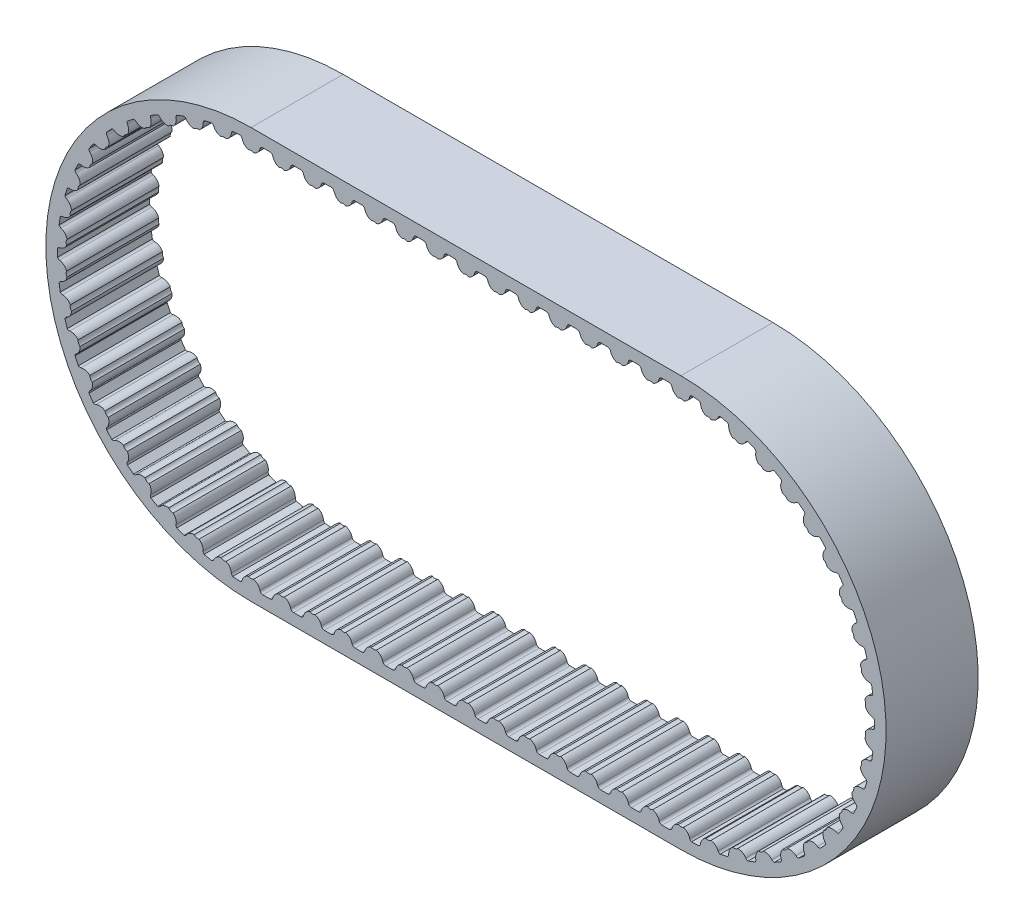
from build123d import *

# Parameters (mm, degrees)
BOSS_EXTRUDE2_DEPTH      = 7.5
BOSS_EXTRUDE2_DEPTH_BACK = 7.5
BOSS_EXTRUDE1_DEPTH      = 7.5
CRVPATTERN3_START        = -7.5
CRVPATTERN3_DEPTH        = 15


# Read off the part's stored shape, not the designer's step: CrvPattern3
with BuildPart() as part:
    # Sketch3 → Boss-Extrude2 (new, two sides: drawn at the far end of the back side and taken through both)
    with BuildSketch(Plane.XY.offset(-BOSS_EXTRUDE2_DEPTH_BACK)):
        with BuildLine():
            Line((-35, -33.422538049), (35, -33.422538049))
            ThreePointArc((35, -33.422538049), (68.422538049, 0), (35, 33.422538049))
            Line((35, 33.422538049), (-35, 33.422538049))
            ThreePointArc((-35, 33.422538049), (-68.422538049, 0), (-35, -33.422538049))
        make_face()
        with BuildLine():
            Line((-35, 31.522538049), (35, 31.522538049))
            ThreePointArc((35, 31.522538049), (66.522538049, 0), (35, -31.522538049))
            Line((35, -31.522538049), (-35, -31.522538049))
            ThreePointArc((-35, -31.522538049), (-66.522538049, 0), (-35, 31.522538049))
        make_face(mode=Mode.SUBTRACT)
    extrude(amount=BOSS_EXTRUDE2_DEPTH + BOSS_EXTRUDE2_DEPTH_BACK)

    # Sketch4 → Boss-Extrude1 (add, symmetric)
    with BuildSketch(Plane.XY):
        with BuildLine():
            Line((-1.936491673, -31.522538049), (1.936491673, -31.522538049))
            ThreePointArc((1.936491673, -31.522538049), (1.630305455, -31.417822757), (1.452368755, -31.147538049))
            ThreePointArc((1.452368755, -31.147538049), (1.075823088, -30.477260726), (0.416666667, -30.08157001))
            ThreePointArc((0.416666667, -30.08157001), (0, -30.193215507), (-0.416666667, -30.08157001))
            ThreePointArc((-0.416666667, -30.08157001), (-1.075823088, -30.477260726), (-1.452368755, -31.147538049))
            ThreePointArc((-1.452368755, -31.147538049), (-1.630305455, -31.417822757), (-1.936491673, -31.522538049))
        make_face()
    extrude(amount=BOSS_EXTRUDE1_DEPTH, both=True)

    # CrvPattern3 outline → CrvPattern3 (add)
    with BuildSketch(Plane.XY.offset(CRVPATTERN3_START)):
        with BuildLine():
            Line((3.063508327, -31.522538049), (6.936491673, -31.522538049))
            ThreePointArc((6.936491673, -31.522538049), (6.630305455, -31.417822757), (6.452368755, -31.147538049))
            ThreePointArc((6.452368755, -31.147538049), (6.075823088, -30.477260726), (5.416666667, -30.08157001))
            ThreePointArc((5.416666667, -30.08157001), (5, -30.193215507), (4.583333333, -30.08157001))
            ThreePointArc((4.583333333, -30.08157001), (3.924176912, -30.477260726), (3.547631245, -31.147538049))
            ThreePointArc((3.547631245, -31.147538049), (3.369694545, -31.417822757), (3.063508327, -31.522538049))
        make_face()
        with BuildLine():
            Line((8.063508327, -31.522538049), (11.936491673, -31.522538049))
            ThreePointArc((11.936491673, -31.522538049), (11.630305455, -31.417822757), (11.452368755, -31.147538049))
            ThreePointArc((11.452368755, -31.147538049), (11.075823088, -30.477260726), (10.416666667, -30.08157001))
            ThreePointArc((10.416666667, -30.08157001), (10, -30.193215507), (9.583333333, -30.08157001))
            ThreePointArc((9.583333333, -30.08157001), (8.924176912, -30.477260726), (8.547631245, -31.147538049))
            ThreePointArc((8.547631245, -31.147538049), (8.369694545, -31.417822757), (8.063508327, -31.522538049))
        make_face()
        with BuildLine():
            Line((13.063508327, -31.522538049), (16.936491673, -31.522538049))
            ThreePointArc((16.936491673, -31.522538049), (16.630305455, -31.417822757), (16.452368755, -31.147538049))
            ThreePointArc((16.452368755, -31.147538049), (16.075823088, -30.477260726), (15.416666667, -30.08157001))
            ThreePointArc((15.416666667, -30.08157001), (15, -30.193215507), (14.583333333, -30.08157001))
            ThreePointArc((14.583333333, -30.08157001), (13.924176912, -30.477260726), (13.547631245, -31.147538049))
            ThreePointArc((13.547631245, -31.147538049), (13.369694545, -31.417822757), (13.063508327, -31.522538049))
        make_face()
        with BuildLine():
            Line((18.063508327, -31.522538049), (21.936491673, -31.522538049))
            ThreePointArc((21.936491673, -31.522538049), (21.630305455, -31.417822757), (21.452368755, -31.147538049))
            ThreePointArc((21.452368755, -31.147538049), (21.075823088, -30.477260726), (20.416666667, -30.08157001))
            ThreePointArc((20.416666667, -30.08157001), (20, -30.193215507), (19.583333333, -30.08157001))
            ThreePointArc((19.583333333, -30.08157001), (18.924176912, -30.477260726), (18.547631245, -31.147538049))
            ThreePointArc((18.547631245, -31.147538049), (18.369694545, -31.417822757), (18.063508327, -31.522538049))
        make_face()
        with BuildLine():
            Line((23.063508327, -31.522538049), (26.936491673, -31.522538049))
            ThreePointArc((26.936491673, -31.522538049), (26.630305455, -31.417822757), (26.452368755, -31.147538049))
            ThreePointArc((26.452368755, -31.147538049), (26.075823088, -30.477260726), (25.416666667, -30.08157001))
            ThreePointArc((25.416666667, -30.08157001), (25, -30.193215507), (24.583333333, -30.08157001))
            ThreePointArc((24.583333333, -30.08157001), (23.924176912, -30.477260726), (23.547631245, -31.147538049))
            ThreePointArc((23.547631245, -31.147538049), (23.369694545, -31.417822757), (23.063508327, -31.522538049))
        make_face()
        with BuildLine():
            Line((28.063508327, -31.522538049), (31.936491673, -31.522538049))
            ThreePointArc((31.936491673, -31.522538049), (31.630305455, -31.417822757), (31.452368755, -31.147538049))
            ThreePointArc((31.452368755, -31.147538049), (31.075823088, -30.477260726), (30.416666667, -30.08157001))
            ThreePointArc((30.416666667, -30.08157001), (30, -30.193215507), (29.583333333, -30.08157001))
            ThreePointArc((29.583333333, -30.08157001), (28.924176912, -30.477260726), (28.547631245, -31.147538049))
            ThreePointArc((28.547631245, -31.147538049), (28.369694545, -31.417822757), (28.063508327, -31.522538049))
        make_face()
        with BuildLine():
            ThreePointArc((35, -31.522538049), (35.862533418, -31.510735332), (36.724420934, -31.475336019))
            ThreePointArc((36.724420934, -31.475336019), (36.551739442, -31.341858767), (36.452368755, -31.147538049))
            ThreePointArc((36.452368755, -31.147538049), (36.075823088, -30.477260726), (35.416666667, -30.08157001))
            ThreePointArc((35.416666667, -30.08157001), (35, -30.193215507), (34.583333333, -30.08157001))
            ThreePointArc((34.583333333, -30.08157001), (33.924176912, -30.477260726), (33.547631245, -31.147538049))
            ThreePointArc((33.547631245, -31.147538049), (33.369694545, -31.417822757), (33.063508327, -31.522538049))
            Line((33.063508327, -31.522538049), (35, -31.522538049))
        make_face()
        with BuildLine():
            ThreePointArc((37.985994832, -31.380794125), (39.698190506, -31.170457344), (41.396315985, -30.866770917))
            ThreePointArc((41.396315985, -30.866770917), (41.205669451, -30.760521337), (41.078446652, -30.583181454))
            ThreePointArc((41.078446652, -30.583181454), (40.606207038, -29.976511793), (39.895438209, -29.683482783))
            ThreePointArc((39.895438209, -29.683482783), (39.500065262, -29.855982237), (39.07141252, -29.807684672))
            ThreePointArc((39.07141252, -29.807684672), (38.478592972, -30.297198015), (38.206152661, -31.016110115))
            ThreePointArc((38.206152661, -31.016110115), (38.136853862, -31.223070862), (37.985994832, -31.380794125))
        make_face()
        with BuildLine():
            ThreePointArc((42.629708408, -30.585257146), (44.291431201, -30.122080129), (45.925327908, -29.568693159))
            ThreePointArc((45.925327908, -29.568693159), (45.720975059, -29.49204469), (45.568742096, -29.335647121))
            ThreePointArc((45.568742096, -29.335647121), (45.011357587, -28.806137122), (44.264853751, -28.622315601))
            ThreePointArc((44.264853751, -28.622315601), (43.899606503, -28.851815658), (43.468543079, -28.867944913))
            ThreePointArc((43.468543079, -28.867944913), (42.955303014, -29.440345966), (42.793053924, -30.191833533))
            ThreePointArc((42.793053924, -30.191833533), (42.755375035, -30.40681115), (42.629708408, -30.585257146))
        make_face()
        with BuildLine():
            ThreePointArc((47.102986906, -29.106496062), (48.677116675, -28.400825419), (50.210286058, -27.610099657))
            ThreePointArc((50.210286058, -27.610099657), (49.9967918, -27.5647645), (49.822949306, -27.432802908))
            ThreePointArc((49.822949306, -27.432802908), (49.192870951, -26.992280949), (48.42730777, -26.921773186))
            ThreePointArc((48.42730777, -26.921773186), (48.10034524, -27.203147194), (47.67650038, -27.283342968))
            ThreePointArc((47.67650038, -27.283342968), (47.254304732, -27.925845237), (47.20587124, -28.69312128))
            ThreePointArc((47.20587124, -28.69312128), (47.200653944, -28.911313522), (47.102986906, -29.106496062))
        make_face()
        with BuildLine():
            ThreePointArc((51.305904675, -26.977543954), (52.757277964, -26.045143201), (54.155471552, -25.034742153))
            ThreePointArc((54.155471552, -25.034742153), (53.937604994, -25.02173302), (53.746036322, -24.91715521))
            ThreePointArc((53.746036322, -24.91715521), (53.057339031, -24.575461822), (52.289817921, -24.619842844))
            ThreePointArc((52.289817921, -24.619842844), (52.008443913, -24.946805373), (51.601285609, -25.089276226))
            ThreePointArc((51.601285609, -25.089276226), (51.279565532, -25.787527271), (51.346029563, -26.553452112))
            ThreePointArc((51.346029563, -26.553452112), (51.373390406, -26.769984924), (51.305904675, -26.977543954))
        make_face()
        with BuildLine():
            ThreePointArc((55.144575479, -24.245958093), (56.440771006, -23.107655522), (57.672755465, -21.900149877))
            ThreePointArc((57.672755465, -21.900149877), (57.455383387, -21.919757371), (57.250367864, -21.844899438))
            ThreePointArc((57.250367864, -21.844899438), (56.518435996, -21.609667488), (55.76610211, -21.767945896))
            ThreePointArc((55.76610211, -21.767945896), (55.536602054, -22.133193144), (55.155225551, -22.334756511))
            ThreePointArc((55.155225551, -22.334756511), (54.941167739, -23.073158558), (55.121044596, -23.820622702))
            ThreePointArc((55.121044596, -23.820622702), (55.180372382, -24.0306591), (55.144575479, -24.245958093))
        make_face()
        with BuildLine():
            ThreePointArc((58.533249755, -20.972757593), (59.645312654, -19.653981002), (60.683567487, -18.276344443))
            ThreePointArc((60.683567487, -18.276344443), (60.471545619, -18.328130564), (60.257662955, -18.28466471))
            ThreePointArc((60.257662955, -18.28466471), (59.498846658, -18.161148891), (58.778505894, -18.429789008))
            ThreePointArc((58.778505894, -18.429789008), (58.606006441, -18.825161954), (58.258931059, -19.081315243))
            ThreePointArc((58.258931059, -19.081315243), (58.157317211, -19.84337361), (58.446588741, -20.555679943))
            ThreePointArc((58.446588741, -20.555679943), (58.536558186, -20.75452806), (58.533249755, -20.972757593))
        make_face()
        with BuildLine():
            ThreePointArc((61.396230118, -17.231060345), (62.299318742, -15.761269025), (63.120651052, -14.244275674))
            ThreePointArc((63.120651052, -14.244275674), (62.918715614, -14.327083607), (62.700743593, -14.315980787))
            ThreePointArc((62.700743593, -14.315980787), (61.93199357, -14.306940239), (61.259737148, -14.679941087))
            ThreePointArc((61.259737148, -14.679941087), (61.148091651, -15.096607754), (60.843070481, -15.401628923))
            ThreePointArc((60.843070481, -15.401628923), (60.856170482, -16.170320487), (61.248374839, -16.831557262))
            ThreePointArc((61.248374839, -16.831557262), (61.366976173, -17.01477516), (61.396230118, -17.231060345))
        make_face()
        with BuildLine():
            ThreePointArc((63.669562319, -13.104449682), (64.34350316, -11.516476341), (64.92956574, -9.894013325))
            ThreePointArc((64.92956574, -9.894013325), (64.742227637, -10.005993276), (64.525035394, -10.02750151))
            ThreePointArc((64.525035394, -10.02750151), (63.76352425, -10.133138183), (63.154369268, -10.60216754))
            ThreePointArc((63.154369268, -10.60216754), (63.106071703, -11.030820282), (62.849918414, -11.377895664))
            ThreePointArc((62.849918414, -11.377895664), (62.977439631, -12.136049124), (63.463815616, -12.731445405))
            ThreePointArc((63.463815616, -12.731445405), (63.608399482, -12.894940298), (63.669562319, -13.104449682))
        make_face()
        with BuildLine():
            ThreePointArc((65.302463873, -8.685107268), (65.732202207, -7.014424607), (66.069903387, -5.322735067))
            ThreePointArc((66.069903387, -5.322735067), (65.901347441, -5.46138559), (65.689786692, -5.515024419))
            ThreePointArc((65.689786692, -5.515024419), (64.952525327, -5.732978564), (64.420079301, -6.28755909))
            ThreePointArc((64.420079301, -6.28755909), (64.436208557, -6.718622514), (64.23464519, -7.099999017))
            ThreePointArc((64.23464519, -7.099999017), (64.47373901, -7.830678478), (65.043421788, -8.346934095))
            ThreePointArc((65.043421788, -8.346934095), (65.210758421, -8.487053779), (65.302463873, -8.685107268))
        make_face()
        with BuildLine():
            ThreePointArc((66.258458458, -4.071753909), (66.434394639, -2.355682218), (66.516190733, -0.632555703))
            ThreePointArc((66.516190733, -0.632555703), (66.370182207, -0.794779575), (66.168978869, -0.879350796))
            ThreePointArc((66.168978869, -0.879350796), (65.472436484, -1.204753678), (65.028593379, -1.83249696))
            ThreePointArc((65.028593379, -1.83249696), (65.108789153, -2.25634182), (64.966318301, -2.663500124))
            ThreePointArc((64.966318301, -2.663500124), (65.311643763, -3.350383415), (65.951907563, -3.775966071))
            ThreePointArc((65.951907563, -3.775966071), (66.138258939, -3.889580502), (66.258458458, -4.071753909))
        make_face()
        with BuildLine():
            ThreePointArc((66.516190733, 0.632555703), (66.434394639, 2.355682218), (66.258458458, 4.071753909))
            ThreePointArc((66.258458458, 4.071753909), (66.138258939, 3.889580502), (65.951907563, 3.775966071))
            ThreePointArc((65.951907563, 3.775966071), (65.311643763, 3.350383415), (64.966318301, 2.663500124))
            ThreePointArc((64.966318301, 2.663500124), (65.108789153, 2.25634182), (65.028593379, 1.83249696))
            ThreePointArc((65.028593379, 1.83249696), (65.472436484, 1.204753678), (66.168978869, 0.879350796))
            ThreePointArc((66.168978869, 0.879350796), (66.370182207, 0.794779575), (66.516190733, 0.632555703))
        make_face()
        with BuildLine():
            ThreePointArc((66.069903387, 5.322735067), (65.732202207, 7.014424607), (65.302463873, 8.685107268))
            ThreePointArc((65.302463873, 8.685107268), (65.210758421, 8.487053779), (65.043421788, 8.346934095))
            ThreePointArc((65.043421788, 8.346934095), (64.47373901, 7.830678478), (64.23464519, 7.099999017))
            ThreePointArc((64.23464519, 7.099999017), (64.436208557, 6.718622514), (64.420079301, 6.28755909))
            ThreePointArc((64.420079301, 6.28755909), (64.952525327, 5.732978564), (65.689786692, 5.515024419))
            ThreePointArc((65.689786692, 5.515024419), (65.901347441, 5.46138559), (66.069903387, 5.322735067))
        make_face()
        with BuildLine():
            ThreePointArc((64.92956574, 9.894013325), (64.34350316, 11.516476341), (63.669562319, 13.104449682))
            ThreePointArc((63.669562319, 13.104449682), (63.608399482, 12.894940298), (63.463815616, 12.731445405))
            ThreePointArc((63.463815616, 12.731445405), (62.977439631, 12.136049124), (62.849918414, 11.377895664))
            ThreePointArc((62.849918414, 11.377895664), (63.106071703, 11.030820282), (63.154369268, 10.60216754))
            ThreePointArc((63.154369268, 10.60216754), (63.76352425, 10.133138183), (64.525035394, 10.02750151))
            ThreePointArc((64.525035394, 10.02750151), (64.742227637, 10.005993276), (64.92956574, 9.894013325))
        make_face()
        with BuildLine():
            ThreePointArc((63.120651052, 14.244275674), (62.299318742, 15.761269025), (61.396230118, 17.231060345))
            ThreePointArc((61.396230118, 17.231060345), (61.366976173, 17.01477516), (61.248374839, 16.831557262))
            ThreePointArc((61.248374839, 16.831557262), (60.856170482, 16.170320487), (60.843070481, 15.401628923))
            ThreePointArc((60.843070481, 15.401628923), (61.148091651, 15.096607754), (61.259737148, 14.679941087))
            ThreePointArc((61.259737148, 14.679941087), (61.93199357, 14.306940239), (62.700743593, 14.315980787))
            ThreePointArc((62.700743593, 14.315980787), (62.918715614, 14.327083607), (63.120651052, 14.244275674))
        make_face()
        with BuildLine():
            ThreePointArc((60.683567487, 18.276344443), (59.645312654, 19.653981002), (58.533249755, 20.972757593))
            ThreePointArc((58.533249755, 20.972757593), (58.536558186, 20.75452806), (58.446588741, 20.555679943))
            ThreePointArc((58.446588741, 20.555679943), (58.157317211, 19.84337361), (58.258931059, 19.081315243))
            ThreePointArc((58.258931059, 19.081315243), (58.606006441, 18.825161954), (58.778505894, 18.429789008))
            ThreePointArc((58.778505894, 18.429789008), (59.498846658, 18.161148891), (60.257662955, 18.28466471))
            ThreePointArc((60.257662955, 18.28466471), (60.471545619, 18.328130564), (60.683567487, 18.276344443))
        make_face()
        with BuildLine():
            ThreePointArc((57.672755465, 21.900149877), (56.440771006, 23.107655522), (55.144575479, 24.245958093))
            ThreePointArc((55.144575479, 24.245958093), (55.180372382, 24.0306591), (55.121044596, 23.820622702))
            ThreePointArc((55.121044596, 23.820622702), (54.941167739, 23.073158558), (55.155225551, 22.334756511))
            ThreePointArc((55.155225551, 22.334756511), (55.536602054, 22.133193144), (55.76610211, 21.767945896))
            ThreePointArc((55.76610211, 21.767945896), (56.518435996, 21.609667488), (57.250367864, 21.844899438))
            ThreePointArc((57.250367864, 21.844899438), (57.455383387, 21.919757371), (57.672755465, 21.900149877))
        make_face()
        with BuildLine():
            ThreePointArc((54.155471552, 25.034742153), (52.757277964, 26.045143201), (51.305904675, 26.977543954))
            ThreePointArc((51.305904675, 26.977543954), (51.373390406, 26.769984924), (51.346029563, 26.553452112))
            ThreePointArc((51.346029563, 26.553452112), (51.279565532, 25.787527271), (51.601285609, 25.089276226))
            ThreePointArc((51.601285609, 25.089276226), (52.008443913, 24.946805373), (52.289817921, 24.619842844))
            ThreePointArc((52.289817921, 24.619842844), (53.057339031, 24.575461822), (53.746036322, 24.91715521))
            ThreePointArc((53.746036322, 24.91715521), (53.937604994, 25.02173302), (54.155471552, 25.034742153))
        make_face()
        with BuildLine():
            ThreePointArc((50.210286058, 27.610099657), (48.677116675, 28.400825419), (47.102986906, 29.106496062))
            ThreePointArc((47.102986906, 29.106496062), (47.200653944, 28.911313522), (47.20587124, 28.69312128))
            ThreePointArc((47.20587124, 28.69312128), (47.254304732, 27.925845237), (47.67650038, 27.283342968))
            ThreePointArc((47.67650038, 27.283342968), (48.10034524, 27.203147194), (48.42730777, 26.921773186))
            ThreePointArc((48.42730777, 26.921773186), (49.192870951, 26.992280949), (49.822949306, 27.432802908))
            ThreePointArc((49.822949306, 27.432802908), (49.9967918, 27.5647645), (50.210286058, 27.610099657))
        make_face()
        with BuildLine():
            ThreePointArc((45.925327908, 29.568693159), (44.291431201, 30.122080129), (42.629708408, 30.585257146))
            ThreePointArc((42.629708408, 30.585257146), (42.755375035, 30.40681115), (42.793053924, 30.191833533))
            ThreePointArc((42.793053924, 30.191833533), (42.955303014, 29.440345966), (43.468543079, 28.867944913))
            ThreePointArc((43.468543079, 28.867944913), (43.899606503, 28.851815658), (44.264853751, 28.622315601))
            ThreePointArc((44.264853751, 28.622315601), (45.011357587, 28.806137122), (45.568742096, 29.335647121))
            ThreePointArc((45.568742096, 29.335647121), (45.720975059, 29.49204469), (45.925327908, 29.568693159))
        make_face()
        with BuildLine():
            ThreePointArc((41.396315985, 30.866770917), (39.698190506, 31.170457344), (37.985994832, 31.380794125))
            ThreePointArc((37.985994832, 31.380794125), (38.136853862, 31.223070862), (38.206152661, 31.016110115))
            ThreePointArc((38.206152661, 31.016110115), (38.478592972, 30.297198015), (39.07141252, 29.807684672))
            ThreePointArc((39.07141252, 29.807684672), (39.500065262, 29.855982237), (39.895438209, 29.683482783))
            ThreePointArc((39.895438209, 29.683482783), (40.606207038, 29.976511793), (41.078446652, 30.583181454))
            ThreePointArc((41.078446652, 30.583181454), (41.205669451, 30.760521337), (41.396315985, 30.866770917))
        make_face()
        with BuildLine():
            Line((35, 31.522538049), (33.063508327, 31.522538049))
            ThreePointArc((33.063508327, 31.522538049), (33.369694545, 31.417822757), (33.547631245, 31.147538049))
            ThreePointArc((33.547631245, 31.147538049), (33.924176912, 30.477260726), (34.583333333, 30.08157001))
            ThreePointArc((34.583333333, 30.08157001), (35, 30.193215507), (35.416666667, 30.08157001))
            ThreePointArc((35.416666667, 30.08157001), (36.075823088, 30.477260726), (36.452368755, 31.147538049))
            ThreePointArc((36.452368755, 31.147538049), (36.551739442, 31.341858767), (36.724420934, 31.475336019))
            ThreePointArc((36.724420934, 31.475336019), (35.862533418, 31.510735332), (35, 31.522538049))
        make_face()
        with BuildLine():
            Line((31.936491673, 31.522538049), (28.063508327, 31.522538049))
            ThreePointArc((28.063508327, 31.522538049), (28.369694545, 31.417822757), (28.547631245, 31.147538049))
            ThreePointArc((28.547631245, 31.147538049), (28.924176912, 30.477260726), (29.583333333, 30.08157001))
            ThreePointArc((29.583333333, 30.08157001), (30, 30.193215507), (30.416666667, 30.08157001))
            ThreePointArc((30.416666667, 30.08157001), (31.075823088, 30.477260726), (31.452368755, 31.147538049))
            ThreePointArc((31.452368755, 31.147538049), (31.630305455, 31.417822757), (31.936491673, 31.522538049))
        make_face()
        with BuildLine():
            Line((26.936491673, 31.522538049), (23.063508327, 31.522538049))
            ThreePointArc((23.063508327, 31.522538049), (23.369694545, 31.417822757), (23.547631245, 31.147538049))
            ThreePointArc((23.547631245, 31.147538049), (23.924176912, 30.477260726), (24.583333333, 30.08157001))
            ThreePointArc((24.583333333, 30.08157001), (25, 30.193215507), (25.416666667, 30.08157001))
            ThreePointArc((25.416666667, 30.08157001), (26.075823088, 30.477260726), (26.452368755, 31.147538049))
            ThreePointArc((26.452368755, 31.147538049), (26.630305455, 31.417822757), (26.936491673, 31.522538049))
        make_face()
        with BuildLine():
            Line((21.936491673, 31.522538049), (18.063508327, 31.522538049))
            ThreePointArc((18.063508327, 31.522538049), (18.369694545, 31.417822757), (18.547631245, 31.147538049))
            ThreePointArc((18.547631245, 31.147538049), (18.924176912, 30.477260726), (19.583333333, 30.08157001))
            ThreePointArc((19.583333333, 30.08157001), (20, 30.193215507), (20.416666667, 30.08157001))
            ThreePointArc((20.416666667, 30.08157001), (21.075823088, 30.477260726), (21.452368755, 31.147538049))
            ThreePointArc((21.452368755, 31.147538049), (21.630305455, 31.417822757), (21.936491673, 31.522538049))
        make_face()
        with BuildLine():
            Line((16.936491673, 31.522538049), (13.063508327, 31.522538049))
            ThreePointArc((13.063508327, 31.522538049), (13.369694545, 31.417822757), (13.547631245, 31.147538049))
            ThreePointArc((13.547631245, 31.147538049), (13.924176912, 30.477260726), (14.583333333, 30.08157001))
            ThreePointArc((14.583333333, 30.08157001), (15, 30.193215507), (15.416666667, 30.08157001))
            ThreePointArc((15.416666667, 30.08157001), (16.075823088, 30.477260726), (16.452368755, 31.147538049))
            ThreePointArc((16.452368755, 31.147538049), (16.630305455, 31.417822757), (16.936491673, 31.522538049))
        make_face()
        with BuildLine():
            Line((11.936491673, 31.522538049), (8.063508327, 31.522538049))
            ThreePointArc((8.063508327, 31.522538049), (8.369694545, 31.417822757), (8.547631245, 31.147538049))
            ThreePointArc((8.547631245, 31.147538049), (8.924176912, 30.477260726), (9.583333333, 30.08157001))
            ThreePointArc((9.583333333, 30.08157001), (10, 30.193215507), (10.416666667, 30.08157001))
            ThreePointArc((10.416666667, 30.08157001), (11.075823088, 30.477260726), (11.452368755, 31.147538049))
            ThreePointArc((11.452368755, 31.147538049), (11.630305455, 31.417822757), (11.936491673, 31.522538049))
        make_face()
        with BuildLine():
            Line((6.936491673, 31.522538049), (3.063508327, 31.522538049))
            ThreePointArc((3.063508327, 31.522538049), (3.369694545, 31.417822757), (3.547631245, 31.147538049))
            ThreePointArc((3.547631245, 31.147538049), (3.924176912, 30.477260726), (4.583333333, 30.08157001))
            ThreePointArc((4.583333333, 30.08157001), (5, 30.193215507), (5.416666667, 30.08157001))
            ThreePointArc((5.416666667, 30.08157001), (6.075823088, 30.477260726), (6.452368755, 31.147538049))
            ThreePointArc((6.452368755, 31.147538049), (6.630305455, 31.417822757), (6.936491673, 31.522538049))
        make_face()
        with BuildLine():
            Line((1.936491673, 31.522538049), (-1.936491673, 31.522538049))
            ThreePointArc((-1.936491673, 31.522538049), (-1.630305455, 31.417822757), (-1.452368755, 31.147538049))
            ThreePointArc((-1.452368755, 31.147538049), (-1.075823088, 30.477260726), (-0.416666667, 30.08157001))
            ThreePointArc((-0.416666667, 30.08157001), (0, 30.193215507), (0.416666667, 30.08157001))
            ThreePointArc((0.416666667, 30.08157001), (1.075823088, 30.477260726), (1.452368755, 31.147538049))
            ThreePointArc((1.452368755, 31.147538049), (1.630305455, 31.417822757), (1.936491673, 31.522538049))
        make_face()
        with BuildLine():
            Line((-3.063508327, 31.522538049), (-6.936491673, 31.522538049))
            ThreePointArc((-6.936491673, 31.522538049), (-6.630305455, 31.417822757), (-6.452368755, 31.147538049))
            ThreePointArc((-6.452368755, 31.147538049), (-6.075823088, 30.477260726), (-5.416666667, 30.08157001))
            ThreePointArc((-5.416666667, 30.08157001), (-5, 30.193215507), (-4.583333333, 30.08157001))
            ThreePointArc((-4.583333333, 30.08157001), (-3.924176912, 30.477260726), (-3.547631245, 31.147538049))
            ThreePointArc((-3.547631245, 31.147538049), (-3.369694545, 31.417822757), (-3.063508327, 31.522538049))
        make_face()
        with BuildLine():
            Line((-8.063508327, 31.522538049), (-11.936491673, 31.522538049))
            ThreePointArc((-11.936491673, 31.522538049), (-11.630305455, 31.417822757), (-11.452368755, 31.147538049))
            ThreePointArc((-11.452368755, 31.147538049), (-11.075823088, 30.477260726), (-10.416666667, 30.08157001))
            ThreePointArc((-10.416666667, 30.08157001), (-10, 30.193215507), (-9.583333333, 30.08157001))
            ThreePointArc((-9.583333333, 30.08157001), (-8.924176912, 30.477260726), (-8.547631245, 31.147538049))
            ThreePointArc((-8.547631245, 31.147538049), (-8.369694545, 31.417822757), (-8.063508327, 31.522538049))
        make_face()
        with BuildLine():
            Line((-13.063508327, 31.522538049), (-16.936491673, 31.522538049))
            ThreePointArc((-16.936491673, 31.522538049), (-16.630305455, 31.417822757), (-16.452368755, 31.147538049))
            ThreePointArc((-16.452368755, 31.147538049), (-16.075823088, 30.477260726), (-15.416666667, 30.08157001))
            ThreePointArc((-15.416666667, 30.08157001), (-15, 30.193215507), (-14.583333333, 30.08157001))
            ThreePointArc((-14.583333333, 30.08157001), (-13.924176912, 30.477260726), (-13.547631245, 31.147538049))
            ThreePointArc((-13.547631245, 31.147538049), (-13.369694545, 31.417822757), (-13.063508327, 31.522538049))
        make_face()
        with BuildLine():
            Line((-18.063508327, 31.522538049), (-21.936491673, 31.522538049))
            ThreePointArc((-21.936491673, 31.522538049), (-21.630305455, 31.417822757), (-21.452368755, 31.147538049))
            ThreePointArc((-21.452368755, 31.147538049), (-21.075823088, 30.477260726), (-20.416666667, 30.08157001))
            ThreePointArc((-20.416666667, 30.08157001), (-20, 30.193215507), (-19.583333333, 30.08157001))
            ThreePointArc((-19.583333333, 30.08157001), (-18.924176912, 30.477260726), (-18.547631245, 31.147538049))
            ThreePointArc((-18.547631245, 31.147538049), (-18.369694545, 31.417822757), (-18.063508327, 31.522538049))
        make_face()
        with BuildLine():
            Line((-23.063508327, 31.522538049), (-26.936491673, 31.522538049))
            ThreePointArc((-26.936491673, 31.522538049), (-26.630305455, 31.417822757), (-26.452368755, 31.147538049))
            ThreePointArc((-26.452368755, 31.147538049), (-26.075823088, 30.477260726), (-25.416666667, 30.08157001))
            ThreePointArc((-25.416666667, 30.08157001), (-25, 30.193215507), (-24.583333333, 30.08157001))
            ThreePointArc((-24.583333333, 30.08157001), (-23.924176912, 30.477260726), (-23.547631245, 31.147538049))
            ThreePointArc((-23.547631245, 31.147538049), (-23.369694545, 31.417822757), (-23.063508327, 31.522538049))
        make_face()
        with BuildLine():
            Line((-28.063508327, 31.522538049), (-31.936491673, 31.522538049))
            ThreePointArc((-31.936491673, 31.522538049), (-31.630305455, 31.417822757), (-31.452368755, 31.147538049))
            ThreePointArc((-31.452368755, 31.147538049), (-31.075823088, 30.477260726), (-30.416666667, 30.08157001))
            ThreePointArc((-30.416666667, 30.08157001), (-30, 30.193215507), (-29.583333333, 30.08157001))
            ThreePointArc((-29.583333333, 30.08157001), (-28.924176912, 30.477260726), (-28.547631245, 31.147538049))
            ThreePointArc((-28.547631245, 31.147538049), (-28.369694545, 31.417822757), (-28.063508327, 31.522538049))
        make_face()
        with BuildLine():
            ThreePointArc((-35, 31.522538049), (-35.862533418, 31.510735332), (-36.724420934, 31.475336019))
            ThreePointArc((-36.724420934, 31.475336019), (-36.551739442, 31.341858767), (-36.452368755, 31.147538049))
            ThreePointArc((-36.452368755, 31.147538049), (-36.075823088, 30.477260726), (-35.416666667, 30.08157001))
            ThreePointArc((-35.416666667, 30.08157001), (-35, 30.193215507), (-34.583333333, 30.08157001))
            ThreePointArc((-34.583333333, 30.08157001), (-33.924176912, 30.477260726), (-33.547631245, 31.147538049))
            ThreePointArc((-33.547631245, 31.147538049), (-33.369694545, 31.417822757), (-33.063508327, 31.522538049))
            Line((-33.063508327, 31.522538049), (-35, 31.522538049))
        make_face()
        with BuildLine():
            ThreePointArc((-37.985994832, 31.380794125), (-39.698190506, 31.170457344), (-41.396315985, 30.866770917))
            ThreePointArc((-41.396315985, 30.866770917), (-41.205669451, 30.760521337), (-41.078446652, 30.583181454))
            ThreePointArc((-41.078446652, 30.583181454), (-40.606207038, 29.976511793), (-39.895438209, 29.683482783))
            ThreePointArc((-39.895438209, 29.683482783), (-39.500065262, 29.855982237), (-39.07141252, 29.807684672))
            ThreePointArc((-39.07141252, 29.807684672), (-38.478592972, 30.297198015), (-38.206152661, 31.016110115))
            ThreePointArc((-38.206152661, 31.016110115), (-38.136853862, 31.223070862), (-37.985994832, 31.380794125))
        make_face()
        with BuildLine():
            ThreePointArc((-42.629708408, 30.585257146), (-44.291431201, 30.122080129), (-45.925327908, 29.568693159))
            ThreePointArc((-45.925327908, 29.568693159), (-45.720975059, 29.49204469), (-45.568742096, 29.335647121))
            ThreePointArc((-45.568742096, 29.335647121), (-45.011357587, 28.806137122), (-44.264853751, 28.622315601))
            ThreePointArc((-44.264853751, 28.622315601), (-43.899606503, 28.851815658), (-43.468543079, 28.867944913))
            ThreePointArc((-43.468543079, 28.867944913), (-42.955303014, 29.440345966), (-42.793053924, 30.191833533))
            ThreePointArc((-42.793053924, 30.191833533), (-42.755375035, 30.40681115), (-42.629708408, 30.585257146))
        make_face()
        with BuildLine():
            ThreePointArc((-47.102986906, 29.106496062), (-48.677116675, 28.400825419), (-50.210286058, 27.610099657))
            ThreePointArc((-50.210286058, 27.610099657), (-49.9967918, 27.5647645), (-49.822949306, 27.432802908))
            ThreePointArc((-49.822949306, 27.432802908), (-49.192870951, 26.992280949), (-48.42730777, 26.921773186))
            ThreePointArc((-48.42730777, 26.921773186), (-48.10034524, 27.203147194), (-47.67650038, 27.283342968))
            ThreePointArc((-47.67650038, 27.283342968), (-47.254304732, 27.925845237), (-47.20587124, 28.69312128))
            ThreePointArc((-47.20587124, 28.69312128), (-47.200653944, 28.911313522), (-47.102986906, 29.106496062))
        make_face()
        with BuildLine():
            ThreePointArc((-51.305904675, 26.977543954), (-52.757277964, 26.045143201), (-54.155471552, 25.034742153))
            ThreePointArc((-54.155471552, 25.034742153), (-53.937604994, 25.02173302), (-53.746036322, 24.91715521))
            ThreePointArc((-53.746036322, 24.91715521), (-53.057339031, 24.575461822), (-52.289817921, 24.619842844))
            ThreePointArc((-52.289817921, 24.619842844), (-52.008443913, 24.946805373), (-51.601285609, 25.089276226))
            ThreePointArc((-51.601285609, 25.089276226), (-51.279565532, 25.787527271), (-51.346029563, 26.553452112))
            ThreePointArc((-51.346029563, 26.553452112), (-51.373390406, 26.769984924), (-51.305904675, 26.977543954))
        make_face()
        with BuildLine():
            ThreePointArc((-55.144575479, 24.245958093), (-56.440771006, 23.107655522), (-57.672755465, 21.900149877))
            ThreePointArc((-57.672755465, 21.900149877), (-57.455383387, 21.919757371), (-57.250367864, 21.844899438))
            ThreePointArc((-57.250367864, 21.844899438), (-56.518435996, 21.609667488), (-55.76610211, 21.767945896))
            ThreePointArc((-55.76610211, 21.767945896), (-55.536602054, 22.133193144), (-55.155225551, 22.334756511))
            ThreePointArc((-55.155225551, 22.334756511), (-54.941167739, 23.073158558), (-55.121044596, 23.820622702))
            ThreePointArc((-55.121044596, 23.820622702), (-55.180372382, 24.0306591), (-55.144575479, 24.245958093))
        make_face()
        with BuildLine():
            ThreePointArc((-58.533249755, 20.972757593), (-59.645312654, 19.653981002), (-60.683567487, 18.276344443))
            ThreePointArc((-60.683567487, 18.276344443), (-60.471545619, 18.328130564), (-60.257662955, 18.28466471))
            ThreePointArc((-60.257662955, 18.28466471), (-59.498846658, 18.161148891), (-58.778505894, 18.429789008))
            ThreePointArc((-58.778505894, 18.429789008), (-58.606006441, 18.825161954), (-58.258931059, 19.081315243))
            ThreePointArc((-58.258931059, 19.081315243), (-58.157317211, 19.84337361), (-58.446588741, 20.555679943))
            ThreePointArc((-58.446588741, 20.555679943), (-58.536558186, 20.75452806), (-58.533249755, 20.972757593))
        make_face()
        with BuildLine():
            ThreePointArc((-61.396230118, 17.231060345), (-62.299318742, 15.761269025), (-63.120651052, 14.244275674))
            ThreePointArc((-63.120651052, 14.244275674), (-62.918715614, 14.327083607), (-62.700743593, 14.315980787))
            ThreePointArc((-62.700743593, 14.315980787), (-61.93199357, 14.306940239), (-61.259737148, 14.679941087))
            ThreePointArc((-61.259737148, 14.679941087), (-61.148091651, 15.096607754), (-60.843070481, 15.401628923))
            ThreePointArc((-60.843070481, 15.401628923), (-60.856170482, 16.170320487), (-61.248374839, 16.831557262))
            ThreePointArc((-61.248374839, 16.831557262), (-61.366976173, 17.01477516), (-61.396230118, 17.231060345))
        make_face()
        with BuildLine():
            ThreePointArc((-63.669562319, 13.104449682), (-64.34350316, 11.516476341), (-64.92956574, 9.894013325))
            ThreePointArc((-64.92956574, 9.894013325), (-64.742227637, 10.005993276), (-64.525035394, 10.02750151))
            ThreePointArc((-64.525035394, 10.02750151), (-63.76352425, 10.133138183), (-63.154369268, 10.60216754))
            ThreePointArc((-63.154369268, 10.60216754), (-63.106071703, 11.030820282), (-62.849918414, 11.377895664))
            ThreePointArc((-62.849918414, 11.377895664), (-62.977439631, 12.136049124), (-63.463815616, 12.731445405))
            ThreePointArc((-63.463815616, 12.731445405), (-63.608399482, 12.894940298), (-63.669562319, 13.104449682))
        make_face()
        with BuildLine():
            ThreePointArc((-65.302463873, 8.685107268), (-65.732202207, 7.014424607), (-66.069903387, 5.322735067))
            ThreePointArc((-66.069903387, 5.322735067), (-65.901347441, 5.46138559), (-65.689786692, 5.515024419))
            ThreePointArc((-65.689786692, 5.515024419), (-64.952525327, 5.732978564), (-64.420079301, 6.28755909))
            ThreePointArc((-64.420079301, 6.28755909), (-64.436208557, 6.718622514), (-64.23464519, 7.099999017))
            ThreePointArc((-64.23464519, 7.099999017), (-64.47373901, 7.830678478), (-65.043421788, 8.346934095))
            ThreePointArc((-65.043421788, 8.346934095), (-65.210758421, 8.487053779), (-65.302463873, 8.685107268))
        make_face()
        with BuildLine():
            ThreePointArc((-66.258458458, 4.071753909), (-66.434394639, 2.355682218), (-66.516190733, 0.632555703))
            ThreePointArc((-66.516190733, 0.632555703), (-66.370182207, 0.794779575), (-66.168978869, 0.879350796))
            ThreePointArc((-66.168978869, 0.879350796), (-65.472436484, 1.204753678), (-65.028593379, 1.83249696))
            ThreePointArc((-65.028593379, 1.83249696), (-65.108789153, 2.25634182), (-64.966318301, 2.663500124))
            ThreePointArc((-64.966318301, 2.663500124), (-65.311643763, 3.350383415), (-65.951907563, 3.775966071))
            ThreePointArc((-65.951907563, 3.775966071), (-66.138258939, 3.889580502), (-66.258458458, 4.071753909))
        make_face()
        with BuildLine():
            ThreePointArc((-66.516190733, -0.632555703), (-66.434394639, -2.355682218), (-66.258458458, -4.071753909))
            ThreePointArc((-66.258458458, -4.071753909), (-66.138258939, -3.889580502), (-65.951907563, -3.775966071))
            ThreePointArc((-65.951907563, -3.775966071), (-65.311643763, -3.350383415), (-64.966318301, -2.663500124))
            ThreePointArc((-64.966318301, -2.663500124), (-65.108789153, -2.25634182), (-65.028593379, -1.83249696))
            ThreePointArc((-65.028593379, -1.83249696), (-65.472436484, -1.204753678), (-66.168978869, -0.879350796))
            ThreePointArc((-66.168978869, -0.879350796), (-66.370182207, -0.794779575), (-66.516190733, -0.632555703))
        make_face()
        with BuildLine():
            ThreePointArc((-66.069903387, -5.322735067), (-65.732202207, -7.014424607), (-65.302463873, -8.685107268))
            ThreePointArc((-65.302463873, -8.685107268), (-65.210758421, -8.487053779), (-65.043421788, -8.346934095))
            ThreePointArc((-65.043421788, -8.346934095), (-64.47373901, -7.830678478), (-64.23464519, -7.099999017))
            ThreePointArc((-64.23464519, -7.099999017), (-64.436208557, -6.718622514), (-64.420079301, -6.28755909))
            ThreePointArc((-64.420079301, -6.28755909), (-64.952525327, -5.732978564), (-65.689786692, -5.515024419))
            ThreePointArc((-65.689786692, -5.515024419), (-65.901347441, -5.46138559), (-66.069903387, -5.322735067))
        make_face()
        with BuildLine():
            ThreePointArc((-64.92956574, -9.894013325), (-64.34350316, -11.516476341), (-63.669562319, -13.104449682))
            ThreePointArc((-63.669562319, -13.104449682), (-63.608399482, -12.894940298), (-63.463815616, -12.731445405))
            ThreePointArc((-63.463815616, -12.731445405), (-62.977439631, -12.136049124), (-62.849918414, -11.377895664))
            ThreePointArc((-62.849918414, -11.377895664), (-63.106071703, -11.030820282), (-63.154369268, -10.60216754))
            ThreePointArc((-63.154369268, -10.60216754), (-63.76352425, -10.133138183), (-64.525035394, -10.02750151))
            ThreePointArc((-64.525035394, -10.02750151), (-64.742227637, -10.005993276), (-64.92956574, -9.894013325))
        make_face()
        with BuildLine():
            ThreePointArc((-63.120651052, -14.244275674), (-62.299318742, -15.761269025), (-61.396230118, -17.231060345))
            ThreePointArc((-61.396230118, -17.231060345), (-61.366976173, -17.01477516), (-61.248374839, -16.831557262))
            ThreePointArc((-61.248374839, -16.831557262), (-60.856170482, -16.170320487), (-60.843070481, -15.401628923))
            ThreePointArc((-60.843070481, -15.401628923), (-61.148091651, -15.096607754), (-61.259737148, -14.679941087))
            ThreePointArc((-61.259737148, -14.679941087), (-61.93199357, -14.306940239), (-62.700743593, -14.315980787))
            ThreePointArc((-62.700743593, -14.315980787), (-62.918715614, -14.327083607), (-63.120651052, -14.244275674))
        make_face()
        with BuildLine():
            ThreePointArc((-60.683567487, -18.276344443), (-59.645312654, -19.653981002), (-58.533249755, -20.972757593))
            ThreePointArc((-58.533249755, -20.972757593), (-58.536558186, -20.75452806), (-58.446588741, -20.555679943))
            ThreePointArc((-58.446588741, -20.555679943), (-58.157317211, -19.84337361), (-58.258931059, -19.081315243))
            ThreePointArc((-58.258931059, -19.081315243), (-58.606006441, -18.825161954), (-58.778505894, -18.429789008))
            ThreePointArc((-58.778505894, -18.429789008), (-59.498846658, -18.161148891), (-60.257662955, -18.28466471))
            ThreePointArc((-60.257662955, -18.28466471), (-60.471545619, -18.328130564), (-60.683567487, -18.276344443))
        make_face()
        with BuildLine():
            ThreePointArc((-57.672755465, -21.900149877), (-56.440771006, -23.107655522), (-55.144575479, -24.245958093))
            ThreePointArc((-55.144575479, -24.245958093), (-55.180372382, -24.0306591), (-55.121044596, -23.820622702))
            ThreePointArc((-55.121044596, -23.820622702), (-54.941167739, -23.073158558), (-55.155225551, -22.334756511))
            ThreePointArc((-55.155225551, -22.334756511), (-55.536602054, -22.133193144), (-55.76610211, -21.767945896))
            ThreePointArc((-55.76610211, -21.767945896), (-56.518435996, -21.609667488), (-57.250367864, -21.844899438))
            ThreePointArc((-57.250367864, -21.844899438), (-57.455383387, -21.919757371), (-57.672755465, -21.900149877))
        make_face()
        with BuildLine():
            ThreePointArc((-54.155471552, -25.034742153), (-52.757277964, -26.045143201), (-51.305904675, -26.977543954))
            ThreePointArc((-51.305904675, -26.977543954), (-51.373390406, -26.769984924), (-51.346029563, -26.553452112))
            ThreePointArc((-51.346029563, -26.553452112), (-51.279565532, -25.787527271), (-51.601285609, -25.089276226))
            ThreePointArc((-51.601285609, -25.089276226), (-52.008443913, -24.946805373), (-52.289817921, -24.619842844))
            ThreePointArc((-52.289817921, -24.619842844), (-53.057339031, -24.575461822), (-53.746036322, -24.91715521))
            ThreePointArc((-53.746036322, -24.91715521), (-53.937604994, -25.02173302), (-54.155471552, -25.034742153))
        make_face()
        with BuildLine():
            ThreePointArc((-50.210286058, -27.610099657), (-48.677116675, -28.400825419), (-47.102986906, -29.106496062))
            ThreePointArc((-47.102986906, -29.106496062), (-47.200653944, -28.911313522), (-47.20587124, -28.69312128))
            ThreePointArc((-47.20587124, -28.69312128), (-47.254304732, -27.925845237), (-47.67650038, -27.283342968))
            ThreePointArc((-47.67650038, -27.283342968), (-48.10034524, -27.203147194), (-48.42730777, -26.921773186))
            ThreePointArc((-48.42730777, -26.921773186), (-49.192870951, -26.992280949), (-49.822949306, -27.432802908))
            ThreePointArc((-49.822949306, -27.432802908), (-49.9967918, -27.5647645), (-50.210286058, -27.610099657))
        make_face()
        with BuildLine():
            ThreePointArc((-45.925327908, -29.568693159), (-44.291431201, -30.122080129), (-42.629708408, -30.585257146))
            ThreePointArc((-42.629708408, -30.585257146), (-42.755375035, -30.40681115), (-42.793053924, -30.191833533))
            ThreePointArc((-42.793053924, -30.191833533), (-42.955303014, -29.440345966), (-43.468543079, -28.867944913))
            ThreePointArc((-43.468543079, -28.867944913), (-43.899606503, -28.851815658), (-44.264853751, -28.622315601))
            ThreePointArc((-44.264853751, -28.622315601), (-45.011357587, -28.806137122), (-45.568742096, -29.335647121))
            ThreePointArc((-45.568742096, -29.335647121), (-45.720975059, -29.49204469), (-45.925327908, -29.568693159))
        make_face()
        with BuildLine():
            ThreePointArc((-41.396315985, -30.866770917), (-39.698190506, -31.170457344), (-37.985994832, -31.380794125))
            ThreePointArc((-37.985994832, -31.380794125), (-38.136853862, -31.223070862), (-38.206152661, -31.016110115))
            ThreePointArc((-38.206152661, -31.016110115), (-38.478592972, -30.297198015), (-39.07141252, -29.807684672))
            ThreePointArc((-39.07141252, -29.807684672), (-39.500065262, -29.855982237), (-39.895438209, -29.683482783))
            ThreePointArc((-39.895438209, -29.683482783), (-40.606207038, -29.976511793), (-41.078446652, -30.583181454))
            ThreePointArc((-41.078446652, -30.583181454), (-41.205669451, -30.760521337), (-41.396315985, -30.866770917))
        make_face()
        with BuildLine():
            Line((-35, -31.522538049), (-33.063508327, -31.522538049))
            ThreePointArc((-33.063508327, -31.522538049), (-33.369694545, -31.417822757), (-33.547631245, -31.147538049))
            ThreePointArc((-33.547631245, -31.147538049), (-33.924176912, -30.477260726), (-34.583333333, -30.08157001))
            ThreePointArc((-34.583333333, -30.08157001), (-35, -30.193215507), (-35.416666667, -30.08157001))
            ThreePointArc((-35.416666667, -30.08157001), (-36.075823088, -30.477260726), (-36.452368755, -31.147538049))
            ThreePointArc((-36.452368755, -31.147538049), (-36.551739442, -31.341858767), (-36.724420934, -31.475336019))
            ThreePointArc((-36.724420934, -31.475336019), (-35.862533418, -31.510735332), (-35, -31.522538049))
        make_face()
        with BuildLine():
            Line((-31.936491673, -31.522538049), (-28.063508327, -31.522538049))
            ThreePointArc((-28.063508327, -31.522538049), (-28.369694545, -31.417822757), (-28.547631245, -31.147538049))
            ThreePointArc((-28.547631245, -31.147538049), (-28.924176912, -30.477260726), (-29.583333333, -30.08157001))
            ThreePointArc((-29.583333333, -30.08157001), (-30, -30.193215507), (-30.416666667, -30.08157001))
            ThreePointArc((-30.416666667, -30.08157001), (-31.075823088, -30.477260726), (-31.452368755, -31.147538049))
            ThreePointArc((-31.452368755, -31.147538049), (-31.630305455, -31.417822757), (-31.936491673, -31.522538049))
        make_face()
        with BuildLine():
            Line((-26.936491673, -31.522538049), (-23.063508327, -31.522538049))
            ThreePointArc((-23.063508327, -31.522538049), (-23.369694545, -31.417822757), (-23.547631245, -31.147538049))
            ThreePointArc((-23.547631245, -31.147538049), (-23.924176912, -30.477260726), (-24.583333333, -30.08157001))
            ThreePointArc((-24.583333333, -30.08157001), (-25, -30.193215507), (-25.416666667, -30.08157001))
            ThreePointArc((-25.416666667, -30.08157001), (-26.075823088, -30.477260726), (-26.452368755, -31.147538049))
            ThreePointArc((-26.452368755, -31.147538049), (-26.630305455, -31.417822757), (-26.936491673, -31.522538049))
        make_face()
        with BuildLine():
            Line((-21.936491673, -31.522538049), (-18.063508327, -31.522538049))
            ThreePointArc((-18.063508327, -31.522538049), (-18.369694545, -31.417822757), (-18.547631245, -31.147538049))
            ThreePointArc((-18.547631245, -31.147538049), (-18.924176912, -30.477260726), (-19.583333333, -30.08157001))
            ThreePointArc((-19.583333333, -30.08157001), (-20, -30.193215507), (-20.416666667, -30.08157001))
            ThreePointArc((-20.416666667, -30.08157001), (-21.075823088, -30.477260726), (-21.452368755, -31.147538049))
            ThreePointArc((-21.452368755, -31.147538049), (-21.630305455, -31.417822757), (-21.936491673, -31.522538049))
        make_face()
        with BuildLine():
            Line((-16.936491673, -31.522538049), (-13.063508327, -31.522538049))
            ThreePointArc((-13.063508327, -31.522538049), (-13.369694545, -31.417822757), (-13.547631245, -31.147538049))
            ThreePointArc((-13.547631245, -31.147538049), (-13.924176912, -30.477260726), (-14.583333333, -30.08157001))
            ThreePointArc((-14.583333333, -30.08157001), (-15, -30.193215507), (-15.416666667, -30.08157001))
            ThreePointArc((-15.416666667, -30.08157001), (-16.075823088, -30.477260726), (-16.452368755, -31.147538049))
            ThreePointArc((-16.452368755, -31.147538049), (-16.630305455, -31.417822757), (-16.936491673, -31.522538049))
        make_face()
        with BuildLine():
            Line((-11.936491673, -31.522538049), (-8.063508327, -31.522538049))
            ThreePointArc((-8.063508327, -31.522538049), (-8.369694545, -31.417822757), (-8.547631245, -31.147538049))
            ThreePointArc((-8.547631245, -31.147538049), (-8.924176912, -30.477260726), (-9.583333333, -30.08157001))
            ThreePointArc((-9.583333333, -30.08157001), (-10, -30.193215507), (-10.416666667, -30.08157001))
            ThreePointArc((-10.416666667, -30.08157001), (-11.075823088, -30.477260726), (-11.452368755, -31.147538049))
            ThreePointArc((-11.452368755, -31.147538049), (-11.630305455, -31.417822757), (-11.936491673, -31.522538049))
        make_face()
        with BuildLine():
            ThreePointArc((-5.416666667, -30.08157001), (-6.075823088, -30.477260726), (-6.452368755, -31.147538049))
            ThreePointArc((-6.452368755, -31.147538049), (-6.630305455, -31.417822757), (-6.936491673, -31.522538049))
            Line((-6.936491673, -31.522538049), (-3.063508327, -31.522538049))
            ThreePointArc((-3.063508327, -31.522538049), (-3.369694545, -31.417822757), (-3.547631245, -31.147538049))
            ThreePointArc((-3.547631245, -31.147538049), (-3.924176912, -30.477260726), (-4.583333333, -30.08157001))
            ThreePointArc((-4.583333333, -30.08157001), (-5, -30.193215507), (-5.416666667, -30.08157001))
        make_face()
    extrude(amount=CRVPATTERN3_DEPTH)


solid = part.part
